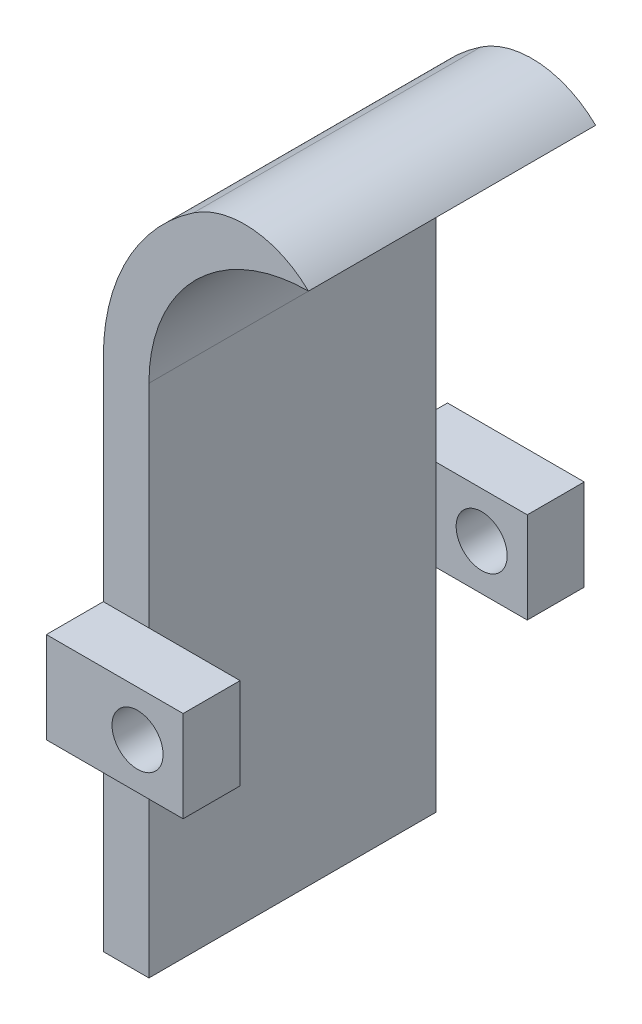
from build123d import *

# Parameters (mm, degrees)
SURFACE_EXTRUDE2_1_DEPTH = 16.002
THICKEN2_T1              = 2.54
FILLET3_R                = 5.08
SURFACE_KNIT2_DEPTH      = 16.002
SKETCH6_R                = 1.4224
BOSS_EXTRUDE1_DEPTH      = 3.175


with BuildPart() as body_1:
    # Surface-Extrude2: a surface, the sketch's curves swept straight by 16.002 mm
    with BuildLine(Plane.XY, mode=Mode.PRIVATE) as surface_extrude2_1_path:
        Line((0, 0), (0, 28.702))
        ThreePointArc((0, 28.702), (2.603820715, 34.988179285), (8.89, 37.592))
    surface_extrude2_1 = Shell.extrude(surface_extrude2_1_path.wire(), (0 * SURFACE_EXTRUDE2_1_DEPTH, 0 * SURFACE_EXTRUDE2_1_DEPTH, 1 * SURFACE_EXTRUDE2_1_DEPTH))
    add(Solid.thicken(surface_extrude2_1, THICKEN2_T1))

    # Fillet3
    # the kernel refuses this fillet: 5.08 mm, written as the material it takes off along each edge
    with BuildSketch(Plane(origin=(8.89, 40.132, -16.731806751), x_dir=(-0.9561828874675108, -0.29277002188457374, 0), z_dir=(0, 0, 1))) as fillet3_piece_1:
        with BuildLine():
            CenterArc((5.205450989, 4.857409068), FILLET3_R, 208.560825218, 78.463040967)
            Line((0.743635856, 2.428704534), (0.654399553, 2.380130443))
            ThreePointArc((0.654399553, 2.380130443), (0.274669746, 1.244097701), (-0.097148181, 0.029745434))
            Line((-0.097148181, 0.029745434), (-0.029745434, -0.097148181))
            ThreePointArc((-0.029745434, -0.097148181), (3.34636135, -0.602429596), (6.722468135, -0.097148181))
            Line((6.722468135, -0.097148181), (6.6927227, 0))
        make_face()
    extrude(amount=49.465613501, mode=Mode.SUBTRACT)


with BuildPart() as body_2:
    # Surface-Knit2: read off the stored shape, not the designer's step
    # Surface-Knit2 outline → Surface-Knit2 (new body)
    with BuildSketch(Plane.XY):
        with BuildLine():
            Line((-2.54, 28.702), (-2.54, 0))
            Line((-2.54, 0), (0, 0))
            Line((0, 0), (0, 28.702))
            ThreePointArc((0, 28.702), (2.603820715, 34.988179285), (8.89, 37.592))
            ThreePointArc((8.89, 37.592), (5.793722616, 39.022651388), (2.490533083, 38.172571429))
            ThreePointArc((2.490533083, 38.172571429), (-1.204325308, 34.063855702), (-2.54, 28.702))
        make_face()
    extrude(amount=SURFACE_KNIT2_DEPTH)

    # Sketch6 → Boss-Extrude1 (add)
    with BuildSketch(Plane.XY.offset(16.002)):
        Polygon((0, 11.811), (5.08, 11.811), (5.08, 16.891), (0, 16.891), (-2.54, 16.891), (-2.54, 11.811), align=None)
        with Locations((2.54, 14.351)):
            Circle(SKETCH6_R, mode=Mode.SUBTRACT)
    boss_extrude1 = extrude(amount=BOSS_EXTRUDE1_DEPTH)

    # Mirror1: Boss-Extrude1 across plane
    add(boss_extrude1.mirror(Plane(origin=(0, 0, 8.001), x_dir=(1, 0, 0), z_dir=(0, 0, -1))))


solid = body_2.part
